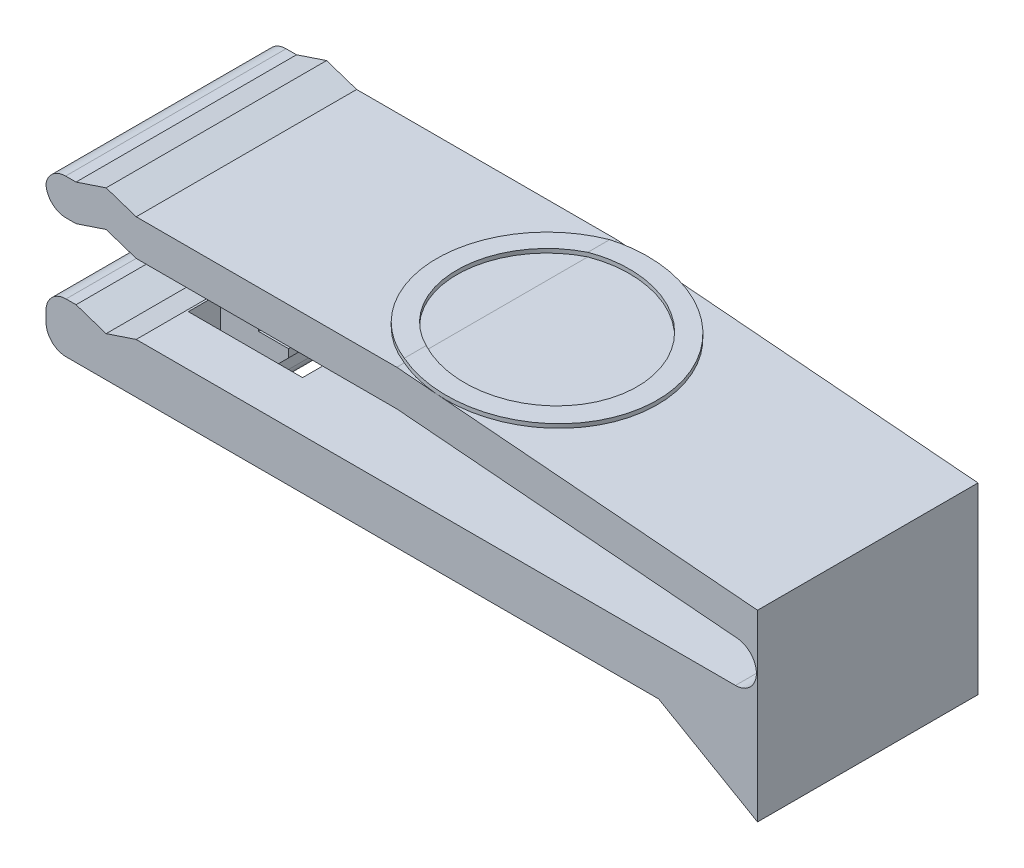
from build123d import *

# Parameters (mm, degrees)
BOSS_EXTRUDE1_DEPTH   = 11
BOSS_EXTRUDE1_2_DEPTH = 11
SKETCH2_W             = 5.7
SKETCH2_H             = 6
CUT_EXTRUDE1_DEPTH    = 3
BOSS_EXTRUDE8_DEPTH   = 11
BOSS_EXTRUDE2_DEPTH   = 6
BOSS_EXTRUDE3_START   = -5.5
BOSS_EXTRUDE3_DEPTH   = 2.5
FILLET7_R             = 1
FILLET8_R             = 1
FILLET10_R            = 1
FILLET11_R            = 1
FILLET12_R            = 0.5
BOSS_EXTRUDE7_REACH   = 45.115
BOSS_EXTRUDE7_START   = 5.5
SKETCH6_R             = 5.5
SKETCH6_R_2           = 4.5
CUT_EXTRUDE3_DEPTH    = 38.615023594
BOSS_EXTRUDE9_DEPTH   = 11


with BuildPart() as part:
    # Sketch1 → Boss-Extrude1 (new body)
    with BuildSketch(Plane.XY):
        Polygon((0, 3.8), (0, 2), (-18, 3.5), (-31, 3.5), (-32.5, 4), (-34, 3.5), (-35.5, 3.5), (-35.5, 5.3), (-34, 5.3), (-32.5, 5.8), (-31, 5.3), (-18, 5.3), align=None)
    extrude(amount=BOSS_EXTRUDE1_DEPTH)



with BuildPart() as body_2:
    # Sketch1 → Boss-Extrude1 2 (new body)
    with BuildSketch(Plane.XY):
        Polygon((0, 0), (0, -2.5), (-35.5, -2.5), (-35.5, 0), (-34, 0), (-32.5, -0.5), (-31, 0), align=None)
    extrude(amount=BOSS_EXTRUDE1_2_DEPTH)

    # Sketch2 → Cut-Extrude1 (cut)
    with BuildSketch(Plane.XZ.offset(2.5)):
        with Locations((-28.05, 5.5)):
            Rectangle(SKETCH2_W, SKETCH2_H)
    extrude(amount=-CUT_EXTRUDE1_DEPTH, mode=Mode.SUBTRACT)


with BuildPart() as part_1:
    add(part.part)

    add(body_2.part)  # Boss-Extrude8 merges body 2
    # Sketch8 → Boss-Extrude8 (add)
    with BuildSketch(Plane(origin=(0, 0, 0), x_dir=(-1, 0, 0), z_dir=(0, 0, -1))):
        with BuildLine():
            Line((1.013298532, 2.084441544), (0, 2))
            Line((0, 2), (0, 0))
            Line((0, 0), (1.1, 0))
            ThreePointArc((1.1, 0), (0.05687804, 1.000635709), (1.013298532, 2.084441544))
        make_face()
    extrude(amount=-BOSS_EXTRUDE8_DEPTH)

    # Sketch3 → Boss-Extrude2 (add)
    with BuildSketch(Plane.XY.offset(2.5)):
        Polygon((-25.2, 0), (-27.2, -2), (-27.2, -2.5), (-25.2, -2.5), align=None)
    extrude(amount=BOSS_EXTRUDE2_DEPTH)

    # Sketch4 → Boss-Extrude3 (add, symmetric)
    with BuildSketch(Plane.XY.offset(11).offset(BOSS_EXTRUDE3_START)):
        with BuildLine():
            Line((-28.4, -2), (-26.4, 0))
            Line((-26.4, 0), (-26.4, 0.4))
            Line((-26.4, 0.4), (-27.9, 0.4))
            Line((-27.9, 0.4), (-27.9, 1.9))
            ThreePointArc((-27.9, 1.9), (-27.43137085, 3.03137085), (-26.3, 3.5))
            Line((-26.3, 3.5), (-29.8, 3.5))
            Line((-29.8, 3.5), (-29.8, -3))
            Line((-29.8, -3), (-28.4, -3))
            Line((-28.4, -3), (-28.4, -2))
        make_face()
    extrude(amount=BOSS_EXTRUDE3_DEPTH, both=True)

    # Fillet7
    fillet7_edges = [part_1.edges().sort_by_distance(p)[0] for p in [
        (-35.5, 0, 5.5),
    ]]
    fillet(fillet7_edges, radius=FILLET7_R)

    # Fillet8
    fillet8_edges = [part_1.edges().sort_by_distance(p)[0] for p in [
        (-35.5, 3.5, 5.5),
    ]]
    fillet(fillet8_edges, radius=FILLET8_R)

    # Fillet10
    # the kernel refuses this fillet: 1 mm, written as the material it takes off along each edge
    with BuildSketch(Plane(origin=(-35.5, 5.3, -2.449489743), x_dir=(1.6076029396566988e-12, -1.0, 0), z_dir=(0, 0, 1))) as fillet10_piece_1:
        with BuildLine():
            CenterArc((1, 0.979795897), FILLET10_R, 180, 78.463040967)
            Line((0, 0.979795897), (-0.02, 0.979795897))
            Line((-0.02, 0.979795897), (-0.02, 0))
            Line((-0.02, 0), (0, -0.02))
            ThreePointArc((0, -0.02), (0.4, -0.02), (0.796, -0.019595918))
            Line((0.796, -0.019595918), (0.8, 0))
        make_face()
    extrude(amount=15.898979486, mode=Mode.SUBTRACT)

    # Fillet11
    fillet11_edges = [part_1.edges().sort_by_distance(p)[0] for p in [
        (-35.5, -2.5, 5.5),
    ]]
    fillet(fillet11_edges, radius=FILLET11_R)

    # Fillet12
    fillet12_edges = [part_1.edges().sort_by_distance(p)[0] for p in [
        (-28.4, -3, 5.5),
        (-29.8, -3, 5.5),
    ]]
    fillet(fillet12_edges, radius=FILLET12_R)

    # Sketch6 → Boss-Extrude7 (add, up to next)
    with BuildSketch(Plane(origin=(0, 0, 0), x_dir=(1, 0, 0), z_dir=(0, 1, 0)).offset(BOSS_EXTRUDE7_START), mode=Mode.PRIVATE) as boss_extrude7_sk1:
        with Locations(Location((-16, -5.5, 0), (0, 0, 270))):
            Circle(SKETCH6_R)
        with Locations(Location((-16, -5.5, 0), (0, 0, 270))):
            Circle(SKETCH6_R_2, mode=Mode.SUBTRACT)
    boss_extrude7_tool1 = extrude(boss_extrude7_sk1.sketch, amount=-BOSS_EXTRUDE7_REACH, mode=Mode.PRIVATE) - part_1.part
    add(boss_extrude7_tool1.solids().sort_by_distance((-16, 5.5, 0.155563))[0])

    # Sketch7 → Cut-Extrude3 (cut, through all)
    with BuildSketch(Plane.XY):
        Polygon((-18, 5.5), (-8, 4.666666667), (-8, 5.5), align=None)
    extrude(amount=CUT_EXTRUDE3_DEPTH, mode=Mode.SUBTRACT)

    # Sketch10 → Boss-Extrude9 (add)
    with BuildSketch(Plane(origin=(0, 0, 0), x_dir=(-1, 0, 0), z_dir=(0, 0, -1))):
        Polygon((0, -2.5), (4.936344802, -2.5), (0, -5.35), align=None)
    extrude(amount=-BOSS_EXTRUDE9_DEPTH)


solid = part_1.part
